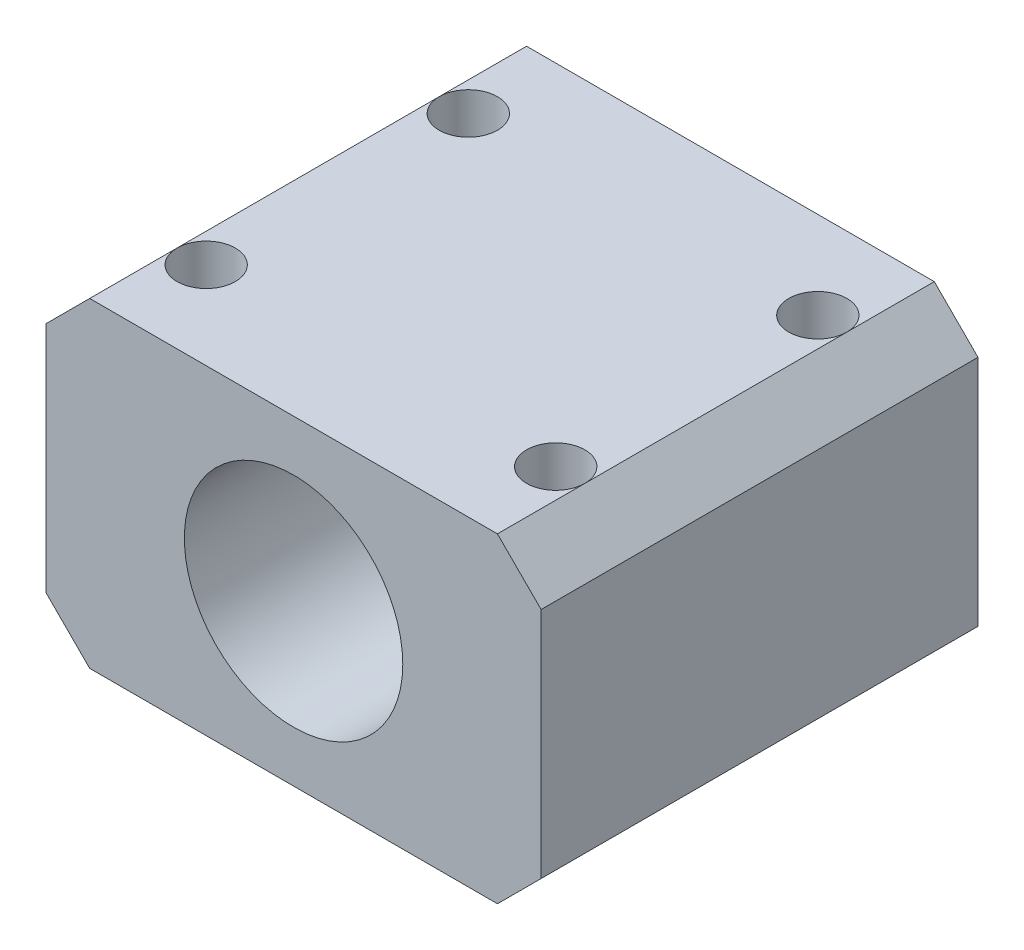
from build123d import *

# Parameters (mm, degrees)
CROQUIS1_W              = 34
CROQUIS1_H              = 22
CROQUIS1_R              = 7.5
SALIENTE_EXTRUIR1_DEPTH = 30
CROQUIS2_R              = 2
CORTAR_EXTRUIR1_DEPTH   = 30
CHAFL_N1_SIZE           = 3


with BuildPart() as part:
    # Croquis1 → Saliente-Extruir1 (new body)
    with BuildSketch(Plane.XY):
        with Locations((0, -11)):
            Rectangle(CROQUIS1_W, CROQUIS1_H)
        with Locations((0, -11)):
            Circle(CROQUIS1_R, mode=Mode.SUBTRACT)
    extrude(amount=SALIENTE_EXTRUIR1_DEPTH)

    # Croquis2 → Cortar-Extruir1 (cut)
    with BuildSketch(Plane(origin=(0, 0, 0), x_dir=(1, 0, 0), z_dir=(0, 1, 0))):
        with Locations(Location((-12, -6, 0), (0, 0, 270))):
            Circle(CROQUIS2_R)
        with Locations(Location((12, -6, 0), (0, 0, 270))):
            Circle(CROQUIS2_R)
        with Locations(Location((-12, -24, 0), (0, 0, 270))):
            Circle(CROQUIS2_R)
        with Locations(Location((12, -24, 0), (0, 0, 270))):
            Circle(CROQUIS2_R)
    extrude(amount=-CORTAR_EXTRUIR1_DEPTH, mode=Mode.SUBTRACT)

    # Chaflán1
    chafl_n1_edges = [part.edges().sort_by_distance(p)[0] for p in [
        (17, -22, 15),
        (-17, -22, 15),
        (-17, 0, 15),
        (17, 0, 15),
    ]]
    chamfer(chafl_n1_edges, length=CHAFL_N1_SIZE - 0.0001)  # a hair under: the kernel refuses the full size


solid = part.part
